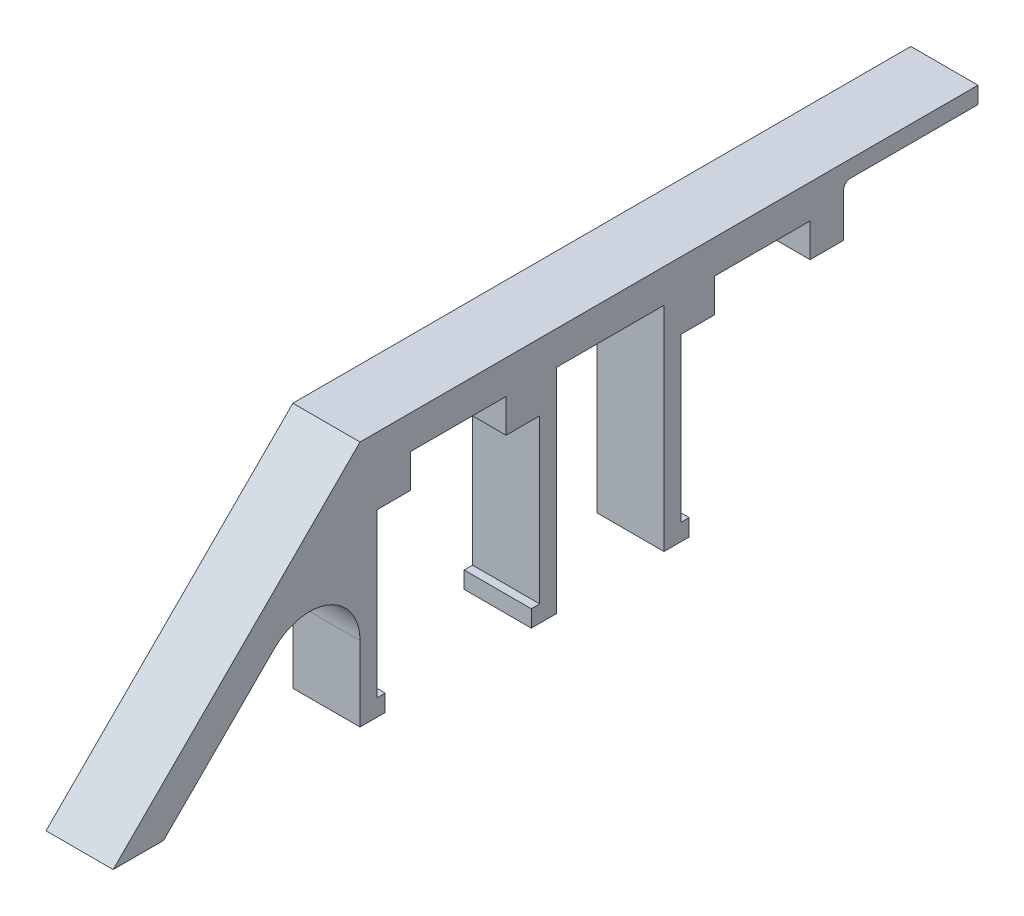
from build123d import *

# Parameters (mm, degrees)
BOSS_EXTRUDE2_DEPTH = 20
FILLET1_R           = 15
FILLET2_R           = 2


with BuildPart() as part:
    # Sketch1 → Boss-Extrude2 (new body)
    with BuildSketch(Plane(origin=(0, 0, 0), x_dir=(0, 0, -1), z_dir=(1, 0, 0))):
        Polygon((-5, 68.5), (-78.5, -5), (-63.5, -5), (-5, 53.5), (-5, -5), (2.5, -5), (2.5, 0), (0, 0), (0, 48.5), (10, 48.5), (10, 58.5), (38.5, 58.5), (38.5, 48.5), (48.5, 48.5), (48.5, 0), (46, 0), (46, -5), (53.5, -5), (53.5, 58.5), (85.5, 58.5), (85.5, -5), (93, -5), (93, 0), (90.5, 0), (90.5, 48.5), (100.5, 48.5), (100.5, 58.5), (129, 58.5), (129, 48.5), (139, 48.5), (139, 63.5), (179, 63.5), (179, 68.5), align=None)
    extrude(amount=BOSS_EXTRUDE2_DEPTH)

    # Fillet1
    fillet1_edges = [part.edges().sort_by_distance(p)[0] for p in [
        (10, 53.5, 5),
    ]]
    fillet(fillet1_edges, radius=FILLET1_R)

    # Fillet2
    fillet2_edges = [part.edges().sort_by_distance(p)[0] for p in [
        (10, 63.5, -139),
    ]]
    fillet(fillet2_edges, radius=FILLET2_R)


solid = part.part
